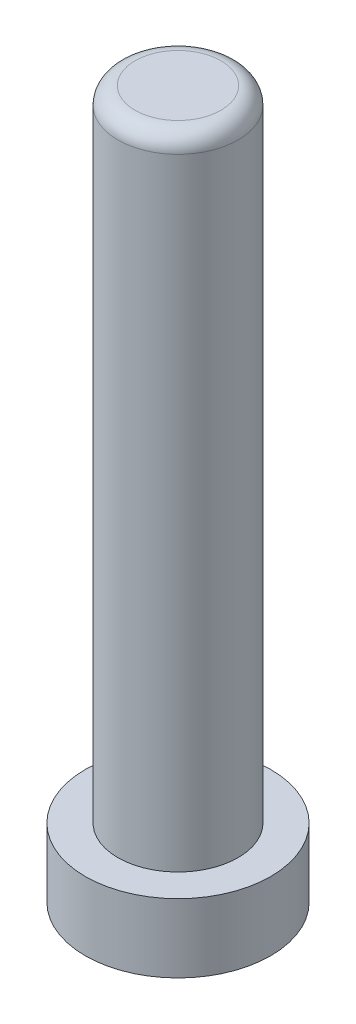
from build123d import *

# Parameters (mm, degrees)
SKETCH1_R           = 2.7
BOSS_EXTRUDE1_DEPTH = 2
SKETCH3_R           = 0.95
CUT_EXTRUDE2_DEPTH  = 9.5
SKETCH2_R           = 1.75
BOSS_EXTRUDE2_DEPTH = 18.6
SKETCH7_R           = 1.2
CUT_EXTRUDE4_DEPTH  = 2.8
FILLET2_R           = 0.5
SKETCH8_R           = 0.95
CUT_EXTRUDE5_DEPTH  = 10.5


with BuildPart() as part:
    # Sketch1 → Boss-Extrude1 (new body)
    with BuildSketch(Plane(origin=(0, 0, 0), x_dir=(1, 0, 0), z_dir=(0, 1, 0))):
        Circle(SKETCH1_R)
    extrude(amount=BOSS_EXTRUDE1_DEPTH)

    # Sketch3 → Cut-Extrude2 (cut)
    with BuildSketch(Plane.XZ):
        Circle(SKETCH3_R)
    extrude(amount=-CUT_EXTRUDE2_DEPTH, mode=Mode.SUBTRACT)

    # Sketch2 → Boss-Extrude2 (add)
    with BuildSketch(Plane(origin=(0, 2, 0), x_dir=(1, 0, 0), z_dir=(0, 1, 0))):
        Circle(SKETCH2_R)
    extrude(amount=BOSS_EXTRUDE2_DEPTH)

    # Sketch7 → Cut-Extrude4 (cut)
    with BuildSketch(Plane.XZ):
        Circle(SKETCH7_R)
    extrude(amount=-CUT_EXTRUDE4_DEPTH, mode=Mode.SUBTRACT)

    # Fillet2
    fillet2_edges = [part.edges().sort_by_distance(p)[0] for p in [
        (-1.75, 20.6, 0),
    ]]
    fillet(fillet2_edges, radius=FILLET2_R)

    # Sketch8 → Cut-Extrude5 (cut)
    with BuildSketch(Plane.XZ):
        Circle(SKETCH8_R)
    extrude(amount=-CUT_EXTRUDE5_DEPTH, mode=Mode.SUBTRACT)


solid = part.part
